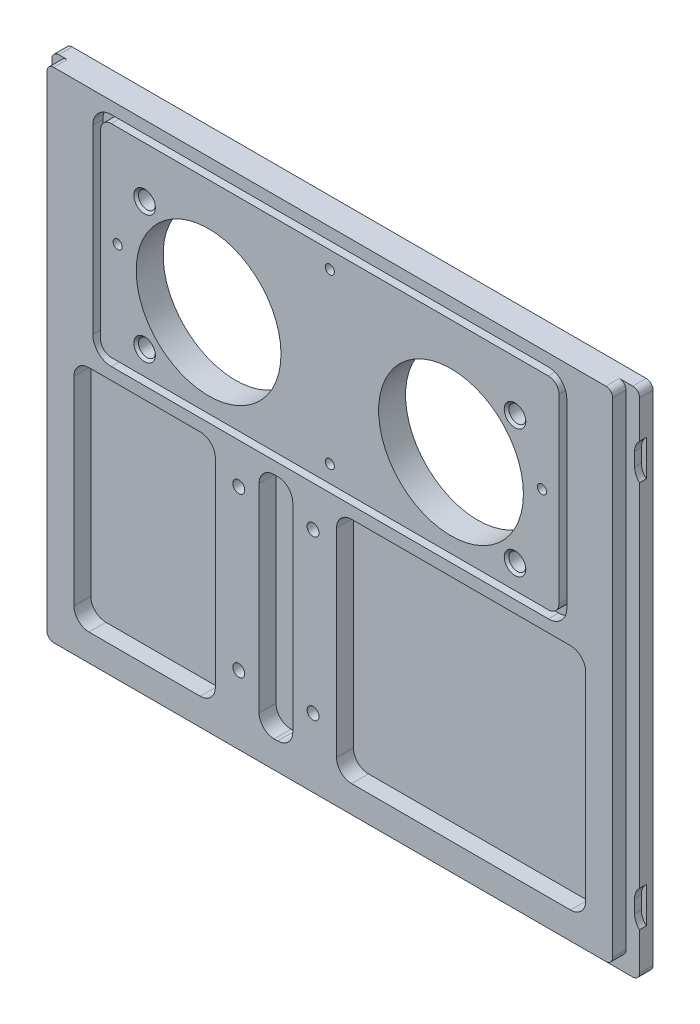
from build123d import *

# Parameters (mm, degrees)
SKETCH1_W                                       = 279.4
SKETCH1_H                                       = 241.3
BOSS_EXTRUDE1_DEPTH                             = 12.7
SKETCH2_R                                       = 34.1376
CUT_EXTRUDE1_DEPTH                              = 274.640060115
F_3_8_16_TAPPED_HOLE1_AT_2_COUNT                = 2
F_3_8_16_TAPPED_HOLE1_AT_2_PITCH                = 60.3504
F_3_8_16_TAPPED_HOLE1_AT_3_COUNT                = 2
F_3_8_16_TAPPED_HOLE1_AT_3_PITCH                = 184.783475994
F_3_8_16_TAPPED_HOLE1_AT_4_COUNT                = 2
F_3_8_16_TAPPED_HOLE1_AT_4_PITCH                = 174.6504
CSK_FOR_12_FLAT_HEAD_MACHINE_SCREW1_D           = 5.6134
CSK_FOR_12_FLAT_HEAD_MACHINE_SCREW1_CSINK_D     = 11.1252
CSK_FOR_12_FLAT_HEAD_MACHINE_SCREW1_CSINK_ANGLE = 82
CUT_EXTRUDE2_DEPTH                              = 7.9502
CUT_EXTRUDE3_DEPTH                              = 4.7752
CSK_FOR_8_FLAT_HEAD_MACHINE_SCREW1_D            = 4.3053
CSK_FOR_8_FLAT_HEAD_MACHINE_SCREW1_CSINK_D      = 8.4328
CSK_FOR_8_FLAT_HEAD_MACHINE_SCREW1_CSINK_ANGLE  = 82
CUT_EXTRUDE4_DEPTH                              = 274.640060115
FILLET1_R                                       = 3.175
CUT_EXTRUDE5_START                              = -6.35
CUT_EXTRUDE5_DEPTH                              = 6.35
FILLET2_R                                       = 3.175
CUT_EXTRUDE6_REACH                              = 278.815
CUT_EXTRUDE6_START                              = 3.175


# Read off the part's stored shape, not the designer's step: Cut-Extrude5
with BuildPart() as part:
    # Sketch1 → Boss-Extrude1 (new body)
    with BuildSketch(Plane.XY):
        with Locations((0, -114.3)):
            Rectangle(SKETCH1_W, SKETCH1_H)
    extrude(amount=BOSS_EXTRUDE1_DEPTH)

    # Sketch2 → Cut-Extrude1 (cut, through all)
    with BuildSketch(Plane.XY):
        with Locations((-57.15, -57.15)):
            Circle(SKETCH2_R)
        with Locations((57.15, -57.15)):
            Circle(SKETCH2_R)
    extrude(amount=CUT_EXTRUDE1_DEPTH, mode=Mode.SUBTRACT)

    # Sketch3 → 3/8-16 Tapped Hole1 (revolve, cut)
    with BuildSketch(Plane(origin=(87.3252, -26.9748, 0), x_dir=(0, 1, 0), z_dir=(1, 0, 0))):
        Polygon((0, 0), (0, 12.7), (5.08, 12.7), (3.96875, 11.58875), (3.96875, 1.11125), (5.08, 0), align=None)
    f_3_8_16_tapped_hole1 = revolve(axis=Axis((87.3252, -26.9748, -6.35), (0, 0, 1)), mode=Mode.SUBTRACT)

    # 3/8-16 Tapped Hole1 at 2: 3/8-16 Tapped Hole1 ×2
    with Locations(*[(0, -i * F_3_8_16_TAPPED_HOLE1_AT_2_PITCH, 0) for i in range(1, F_3_8_16_TAPPED_HOLE1_AT_2_COUNT)]):
        add(f_3_8_16_tapped_hole1, mode=Mode.SUBTRACT)

    # 3/8-16 Tapped Hole1 at 3: 3/8-16 Tapped Hole1 ×2
    with Locations(*[Vector(-0.9451624343615008, -0.3266006317688955, 0) * (i * F_3_8_16_TAPPED_HOLE1_AT_3_PITCH) for i in range(1, F_3_8_16_TAPPED_HOLE1_AT_3_COUNT)]):
        add(f_3_8_16_tapped_hole1, mode=Mode.SUBTRACT)

    # 3/8-16 Tapped Hole1 at 4: 3/8-16 Tapped Hole1 ×2
    with Locations(*[(-i * F_3_8_16_TAPPED_HOLE1_AT_4_PITCH, 0, 0) for i in range(1, F_3_8_16_TAPPED_HOLE1_AT_4_COUNT)]):
        add(f_3_8_16_tapped_hole1, mode=Mode.SUBTRACT)

    # CSK for #12 Flat Head Machine Screw1 (through all)
    with Locations(Plane(origin=(0, 0, 0), x_dir=(-1, 0, 0), z_dir=(0, 0, -1))):
        with Locations((42.9, -121.25), (7.9, -121.25), (7.9, -196.25), (42.9, -196.25)):
            CounterSinkHole(CSK_FOR_12_FLAT_HEAD_MACHINE_SCREW1_D / 2, CSK_FOR_12_FLAT_HEAD_MACHINE_SCREW1_CSINK_D / 2, counter_sink_angle=CSK_FOR_12_FLAT_HEAD_MACHINE_SCREW1_CSINK_ANGLE)

    # Sketch8 → Cut-Extrude2 (cut)
    with BuildSketch(Plane.XY.offset(12.7)):
        with BuildLine():
            Line((-113.538, -107.95), (-61.087, -107.95))
            ThreePointArc((-61.087, -107.95), (-56.058056572, -110.033056572), (-53.975, -115.062))
            Line((-53.975, -115.062), (-53.975, -208.788))
            ThreePointArc((-53.975, -208.788), (-56.058056572, -213.816943428), (-61.087, -215.9))
            Line((-61.087, -215.9), (-113.538, -215.9))
            ThreePointArc((-113.538, -215.9), (-118.566943428, -213.816943428), (-120.65, -208.788))
            Line((-120.65, -208.788), (-120.65, -115.062))
            ThreePointArc((-120.65, -115.062), (-118.566943428, -110.033056572), (-113.538, -107.95))
        make_face()
        with BuildLine():
            Line((10.287, -107.95), (113.538, -107.95))
            ThreePointArc((113.538, -107.95), (118.566943428, -110.033056572), (120.65, -115.062))
            Line((120.65, -115.062), (120.65, -208.788))
            ThreePointArc((120.65, -208.788), (118.566943428, -213.816943428), (113.538, -215.9))
            Line((113.538, -215.9), (10.287, -215.9))
            ThreePointArc((10.287, -215.9), (5.258056572, -213.816943428), (3.175, -208.788))
            Line((3.175, -208.788), (3.175, -115.062))
            ThreePointArc((3.175, -115.062), (5.258056572, -110.033056572), (10.287, -107.95))
        make_face()
        with BuildLine():
            Line((-26.2255, -107.95), (-24.5745, -107.95))
            ThreePointArc((-24.5745, -107.95), (-19.545556572, -110.033056572), (-17.4625, -115.062))
            Line((-17.4625, -115.062), (-17.4625, -208.788))
            ThreePointArc((-17.4625, -208.788), (-19.545556572, -213.816943428), (-24.5745, -215.9))
            Line((-24.5745, -215.9), (-26.2255, -215.9))
            ThreePointArc((-26.2255, -215.9), (-31.254443428, -213.816943428), (-33.3375, -208.788))
            Line((-33.3375, -208.788), (-33.3375, -115.062))
            ThreePointArc((-33.3375, -115.062), (-31.254443428, -110.033056572), (-26.2255, -107.95))
        make_face()
    extrude(amount=-CUT_EXTRUDE2_DEPTH, mode=Mode.SUBTRACT)

    # Sketch9 → Cut-Extrude3 (cut)
    with BuildSketch(Plane.XY.offset(12.7)):
        with BuildLine():
            Line((-103.0351, 0.635), (103.0351, 0.635))
            ThreePointArc((103.0351, 0.635), (109.204535955, -1.920464045), (111.76, -8.0899))
            Line((111.76, -8.0899), (111.76, -93.5101))
            ThreePointArc((111.76, -93.5101), (109.204535955, -99.679535955), (103.0351, -102.235))
            Line((103.0351, -102.235), (-103.0351, -102.235))
            ThreePointArc((-103.0351, -102.235), (-109.204535955, -99.679535955), (-111.76, -93.5101))
            Line((-111.76, -93.5101), (-111.76, -8.0899))
            ThreePointArc((-111.76, -8.0899), (-109.204535955, -1.920464045), (-103.0351, 0.635))
        make_face()
        with BuildLine():
            Line((108.077, -8.0899), (108.077, -93.5101))
            ThreePointArc((108.077, -93.5101), (106.60026168, -97.07526168), (103.0351, -98.552))
            Line((103.0351, -98.552), (-103.0351, -98.552))
            ThreePointArc((-103.0351, -98.552), (-106.60026168, -97.07526168), (-108.077, -93.5101))
            Line((-108.077, -93.5101), (-108.077, -8.0899))
            ThreePointArc((-108.077, -8.0899), (-106.60026168, -4.52473832), (-103.0351, -3.048))
            Line((-103.0351, -3.048), (103.0351, -3.048))
            ThreePointArc((103.0351, -3.048), (106.60026168, -4.52473832), (108.077, -8.0899))
        make_face(mode=Mode.SUBTRACT)
    extrude(amount=-CUT_EXTRUDE3_DEPTH, mode=Mode.SUBTRACT)

    # CSK for #8 Flat Head Machine Screw1 (through all)
    with Locations(Plane(origin=(0, 0, 0), x_dir=(-1, 0, 0), z_dir=(0, 0, -1))):
        with Locations((100.0252, -50.8), (0, -11.0998), (-100.0252, -50.8), (0, -90.4748)):
            CounterSinkHole(CSK_FOR_8_FLAT_HEAD_MACHINE_SCREW1_D / 2, CSK_FOR_8_FLAT_HEAD_MACHINE_SCREW1_CSINK_D / 2, counter_sink_angle=CSK_FOR_8_FLAT_HEAD_MACHINE_SCREW1_CSINK_ANGLE)

    # Sketch12 → Cut-Extrude4 (cut, through all)
    with BuildSketch(Plane.XY):
        with BuildLine():
            Line((-137.3378, 23.951822796), (-137.3378, -11.1252))
            ThreePointArc((-137.3378, -11.1252), (-139.42829606, -16.17210394), (-144.4752, -18.2626))
            Line((-144.4752, -18.2626), (-144.4752, 23.951822796))
            Line((-144.4752, 23.951822796), (-137.3378, 23.951822796))
        make_face()
    extrude(amount=CUT_EXTRUDE4_DEPTH, mode=Mode.SUBTRACT)

    # Fillet1
    fillet1_edges = [part.edges().sort_by_distance(p)[0] for p in [
        (-137.3378, 6.35, 6.35),
        (139.7, 6.35, 6.35),
        (139.7, -234.95, 6.35),
        (-139.7, -234.95, 6.35),
    ]]
    fillet(fillet1_edges, radius=FILLET1_R)

    # Cut-Extrude5 outline → Cut-Extrude5 (cut)
    with BuildSketch(Plane.XY.offset(12.7).offset(CUT_EXTRUDE5_START)):
        with BuildLine():
            Line((-133.35, -228.6), (-133.35, 6.35))
            Line((-133.35, 6.35), (-134.1628, 6.35))
            ThreePointArc((-134.1628, 6.35), (-136.40786403, 5.42006403), (-137.3378, 3.175))
            Line((-137.3378, 3.175), (-137.3378, -11.1252))
            ThreePointArc((-137.3378, -11.1252), (-137.955039295, -14.028643325), (-139.7, -16.429909579))
            Line((-139.7, -16.429909579), (-139.7, -231.775))
            ThreePointArc((-139.7, -231.775), (-138.77006403, -234.02006403), (-136.525, -234.95))
            Line((-136.525, -234.95), (136.525, -234.95))
            ThreePointArc((136.525, -234.95), (138.77006403, -234.02006403), (139.7, -231.775))
            Line((139.7, -231.775), (139.7, 3.175))
            ThreePointArc((139.7, 3.175), (138.77006403, 5.42006403), (136.525, 6.35))
            Line((136.525, 6.35), (133.35, 6.35))
            Line((133.35, 6.35), (133.35, -228.6))
            Line((133.35, -228.6), (-133.35, -228.6))
        make_face()
    extrude(amount=CUT_EXTRUDE5_DEPTH, mode=Mode.SUBTRACT)

    # Fillet2
    fillet2_edges = [part.edges().sort_by_distance(p)[0] for p in [
        (133.35, 6.35, 9.525),
        (-133.35, 6.35, 9.525),
        (133.35, -228.6, 9.525),
        (-133.35, -228.6, 9.525),
    ]]
    fillet(fillet2_edges, radius=FILLET2_R)

    # Sketch14 → Cut-Extrude6 (cut, up to next)
    with BuildSketch(Plane.XY.offset(CUT_EXTRUDE6_START), mode=Mode.PRIVATE) as cut_extrude6_sk1:
        with BuildLine():
            Line((144.5006, -12.7254), (162.7632, -12.7254))
            Line((162.7632, -12.7254), (162.7632, -33.3502))
            Line((162.7632, -33.3502), (144.5006, -33.3502))
            ThreePointArc((144.5006, -33.3502), (139.45369606, -31.25970394), (137.3632, -26.2128))
            Line((137.3632, -26.2128), (137.3632, -19.8628))
            ThreePointArc((137.3632, -19.8628), (139.45369606, -14.81589606), (144.5006, -12.7254))
        make_face()
    cut_extrude6_tool1 = extrude(cut_extrude6_sk1.sketch, amount=CUT_EXTRUDE6_REACH, mode=Mode.PRIVATE) & part.part
    # Sketch14 → Cut-Extrude6 (cut, up to next)
    with BuildSketch(Plane.XY.offset(CUT_EXTRUDE6_START), mode=Mode.PRIVATE) as cut_extrude6_sk2:
        with BuildLine():
            Line((144.5006, -195.2498), (162.7632, -195.2498))
            Line((162.7632, -195.2498), (162.7632, -215.8746))
            Line((162.7632, -215.8746), (144.5006, -215.8746))
            ThreePointArc((144.5006, -215.8746), (139.45369606, -213.78410394), (137.3632, -208.7372))
            Line((137.3632, -208.7372), (137.3632, -202.3872))
            ThreePointArc((137.3632, -202.3872), (139.45369606, -197.34029606), (144.5006, -195.2498))
        make_face()
    cut_extrude6_tool2 = extrude(cut_extrude6_sk2.sketch, amount=CUT_EXTRUDE6_REACH, mode=Mode.PRIVATE) & part.part
    add(cut_extrude6_tool1.solids().sort_by_distance((150.546907, -23.0378, 3.175))[0], mode=Mode.SUBTRACT)
    add(cut_extrude6_tool2.solids().sort_by_distance((150.546907, -205.5622, 3.175))[0], mode=Mode.SUBTRACT)


solid = part.part
